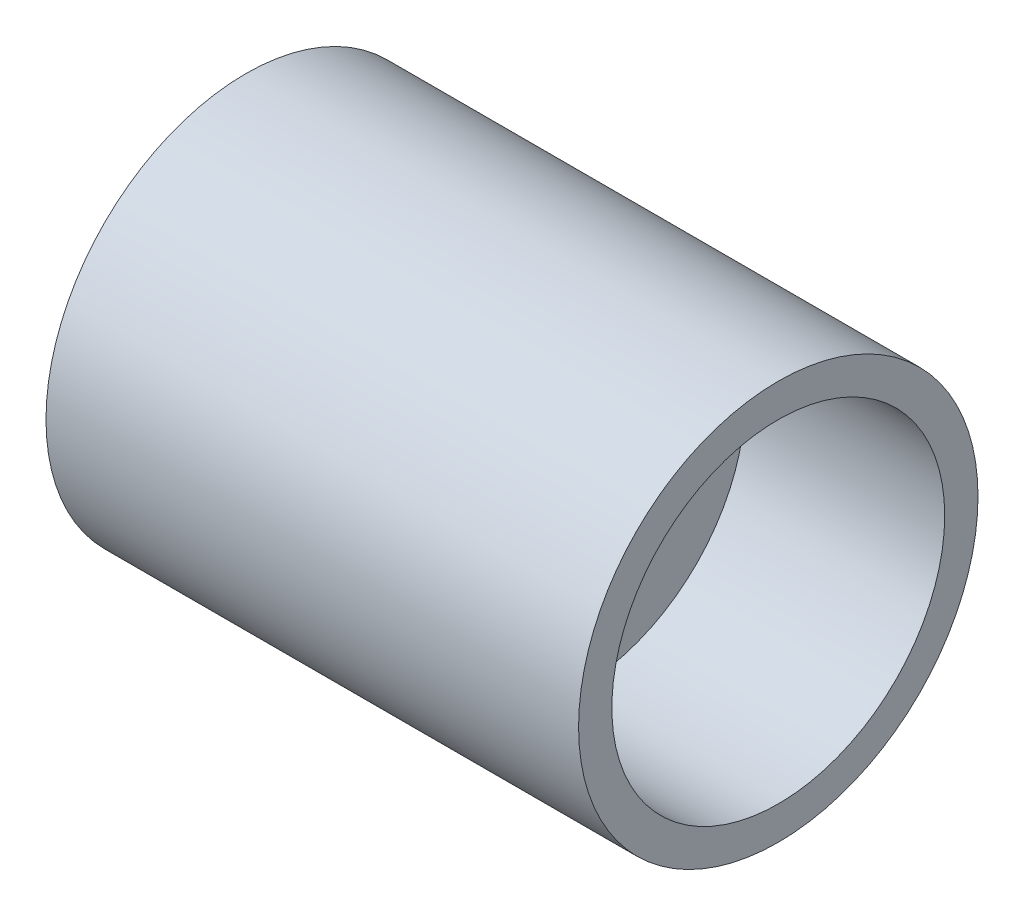
from build123d import *

# Parameters (mm, degrees)
SKETCH1_R           = 3
BOSS_EXTRUDE1_DEPTH = 8
SKETCH2_R           = 2.5
CUT_EXTRUDE1_DEPTH  = 3
CUT_EXTRUDE2_START  = -2
SKETCH3_R           = 2.5
CUT_EXTRUDE2_DEPTH  = 2


with BuildPart() as part:
    # Sketch1 → Boss-Extrude1 (new body)
    with BuildSketch(Plane(origin=(0, 0, 0), x_dir=(0, 0, -1), z_dir=(1, 0, 0))):
        Circle(SKETCH1_R)
    extrude(amount=BOSS_EXTRUDE1_DEPTH)

    # Sketch2 → Cut-Extrude1 (cut)
    with BuildSketch(Plane(origin=(8, 0, 0), x_dir=(0, 0, -1), z_dir=(1, 0, 0))):
        Circle(SKETCH2_R)
    extrude(amount=-CUT_EXTRUDE1_DEPTH, mode=Mode.SUBTRACT)

    # Sketch3 → Cut-Extrude2 (cut)
    with BuildSketch(Plane.ZY.offset(CUT_EXTRUDE2_START)):
        Circle(SKETCH3_R)
    extrude(amount=CUT_EXTRUDE2_DEPTH, mode=Mode.SUBTRACT)


solid = part.part
